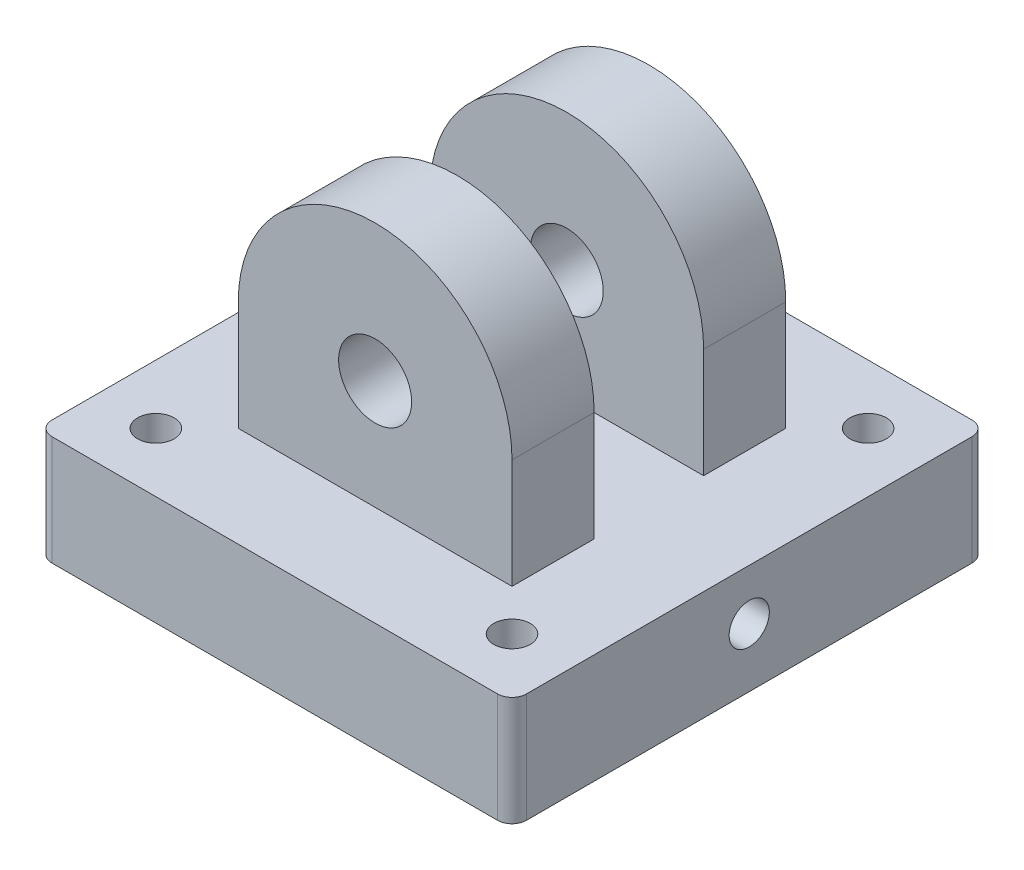
from build123d import *

# Parameters (mm, degrees)
SKETCH1_W           = 165.1
SKETCH1_H           = 165.1
SKETCH1_R           = 6.35
BOSS_EXTRUDE1_DEPTH = 38.1
BOSS_EXTRUDE2_START = 19.05
SKETCH2_R           = 12.7
BOSS_EXTRUDE2_DEPTH = 28.575
SKETCH3_R           = 26
CUT_EXTRUDE1_DEPTH  = 36.83
SKETCH4_R           = 7
CUT_EXTRUDE2_DEPTH  = 74.83
CUT_EXTRUDE3_START  = -38.1
CUT_EXTRUDE3_DEPTH  = 17.554240545
FILLET1_R           = 5
SKETCH6_R           = 76.2
SKETCH6_R_2         = 69.85
CUT_EXTRUDE4_DEPTH  = 8


# Read off the part's stored shape, not the designer's step: Cut-Extrude3
with BuildPart() as part:
    # Sketch1 → Boss-Extrude1 (new body)
    with BuildSketch(Plane(origin=(0, 0, 0), x_dir=(1, 0, 0), z_dir=(0, 1, 0))):
        Rectangle(SKETCH1_W, SKETCH1_H)
        with Locations(Location((-61.963767235, 61.963767235, 0), (0, 0, 90))):
            Circle(SKETCH1_R, mode=Mode.SUBTRACT)
        with Locations(Location((61.963767235, 61.963767235, 0), (0, 0, 90))):
            Circle(SKETCH1_R, mode=Mode.SUBTRACT)
        with Locations(Location((61.963767235, -61.963767235, 0), (0, 0, 90))):
            Circle(SKETCH1_R, mode=Mode.SUBTRACT)
        with Locations(Location((-61.963767235, -61.963767235, 0), (0, 0, 90))):
            Circle(SKETCH1_R, mode=Mode.SUBTRACT)
    extrude(amount=BOSS_EXTRUDE1_DEPTH)

    # Sketch2 → Boss-Extrude2 (add)
    with BuildSketch(Plane.XY.offset(BOSS_EXTRUDE2_START)):
        with BuildLine():
            Line((-47.625, 76.2), (-47.625, 38.1))
            Line((-47.625, 38.1), (47.625, 38.1))
            Line((47.625, 38.1), (47.625, 76.2))
            ThreePointArc((47.625, 76.2), (0, 123.825), (-47.625, 76.2))
        make_face()
        with Locations((0, 76.2)):
            Circle(SKETCH2_R, mode=Mode.SUBTRACT)
    boss_extrude2 = extrude(amount=BOSS_EXTRUDE2_DEPTH)

    # Mirror1: Boss-Extrude2 across plane
    add(boss_extrude2.mirror(Plane.XY))

    # Sketch3 → Cut-Extrude1 (cut)
    with BuildSketch(Plane.XZ):
        with Locations(Location((0, 0, 0), (0, 0, 270))):
            Circle(SKETCH3_R)
    extrude(amount=-CUT_EXTRUDE1_DEPTH, mode=Mode.SUBTRACT)

    # Sketch4 → Cut-Extrude2 (cut)
    with BuildSketch(Plane(origin=(82.55, 0, 0), x_dir=(0, 0, -1), z_dir=(1, 0, 0))):
        with Locations((0, 20.5)):
            Circle(SKETCH4_R)
    extrude(amount=-CUT_EXTRUDE2_DEPTH, mode=Mode.SUBTRACT)

    # Cut-Extrude3 outline → Cut-Extrude3 (cut)
    with BuildSketch(Plane(origin=(0, 38.1, 0), x_dir=(1, 0, 0), z_dir=(0, 1, 0)).offset(CUT_EXTRUDE3_START)):
        with BuildLine():
            add(Edge.make_bspline(
                [(50.55, -6.35), (51.47422126, -6.35), (52.302466674, -6.153856691), (53.750900163, -5.540336611), (54.377469866, -5.126654902), (55.505405632, -4.046735856), (55.989700628, -3.386313597), (56.692940175, -1.822566515), (56.897346558, -0.923572623), (56.902599966, 0.886717767), (56.699688489, 1.798962244), (56.004003016, 3.362853664), (55.518127515, 4.030235701), (54.400965604, 5.108341681), (53.760643664, 5.533511906), (52.329554982, 6.145011865), (51.480571337, 6.347463595), (50.110922006, 6.351232148), (49.655780423, 6.301077578), (48.823880157, 6.125660583), (48.443917363, 6.00347472), (47.356446167, 5.544626686), (46.727263651, 5.130170088), (45.598462304, 4.051448232), (45.112857079, 3.390908719), (44.407214336, 1.82399818), (44.202597079, 0.923991808), (44.197454079, -0.88794427), (44.40080252, -1.801200354), (45.098290108, -3.366869707), (45.585297177, -4.034583157), (46.704472395, -5.112538783), (47.346247575, -5.537622225), (48.779720786, -6.147796435), (49.62577874, -6.35), (50.55, -6.35)],
                knots=[0, 0, 0, 0, 0.0625, 0.0625, 0.125, 0.125, 0.1875, 0.1875, 0.25, 0.25, 0.3125, 0.3125, 0.375, 0.375, 0.4375, 0.4375, 0.5, 0.5, 0.53125, 0.53125, 0.5625, 0.5625, 0.625, 0.625, 0.6875, 0.6875, 0.75, 0.75, 0.8125, 0.8125, 0.875, 0.875, 0.9375, 0.9375, 1, 1, 1, 1], degree=3))
        make_face()
    extrude(amount=CUT_EXTRUDE3_DEPTH, mode=Mode.SUBTRACT)

    # Fillet1
    fillet1_edges = [part.edges().sort_by_distance(p)[0] for p in [
        (82.55, 19.05, 82.55),
        (-82.55, 19.05, 82.55),
        (-82.55, 19.05, -82.55),
        (82.55, 19.05, -82.55),
    ]]
    fillet(fillet1_edges, radius=FILLET1_R)

    # Sketch6 → Cut-Extrude4 (cut)
    with BuildSketch(Plane.XZ):
        with Locations(Location((0, 0, 0), (0, 0, 270))):
            Circle(SKETCH6_R)
        with Locations(Location((0, 0, 0), (0, 0, 270))):
            Circle(SKETCH6_R_2, mode=Mode.SUBTRACT)
    extrude(amount=-CUT_EXTRUDE4_DEPTH, mode=Mode.SUBTRACT)


solid = part.part
